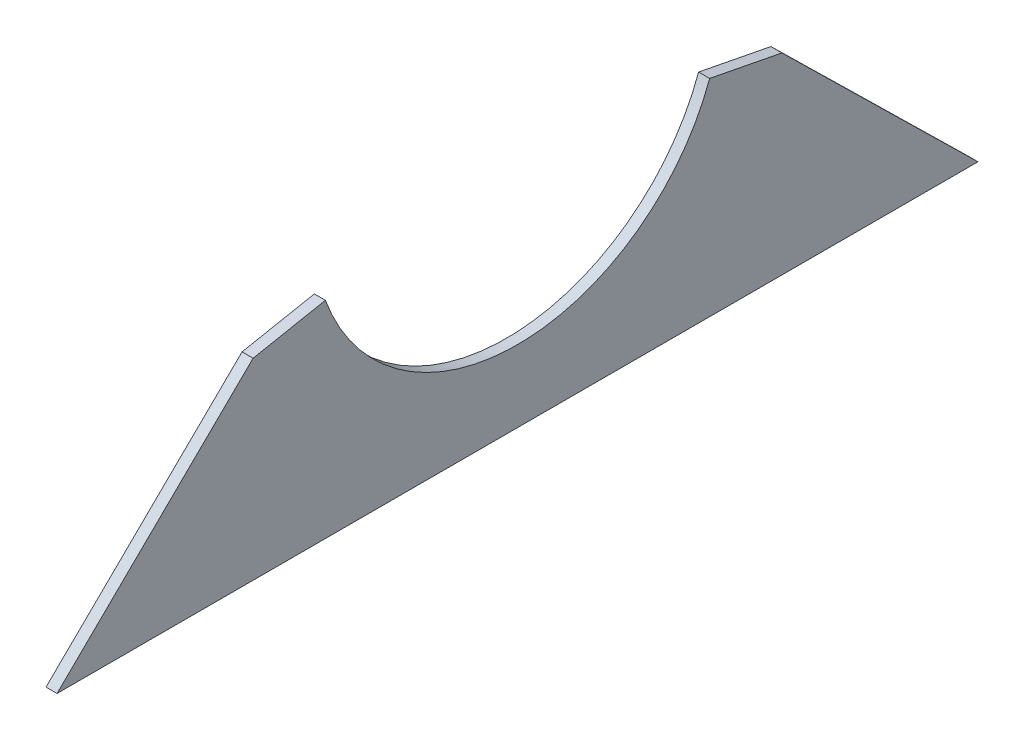
from build123d import *

# Parameters (mm, degrees)
SM_BASE_FLANGE_1_DEPTH = 6


# Sheet-metal steps are written as plain solids
with BuildPart() as part:
    # Sketch 1 → Базовая кромка1 (new body)
    with BuildSketch(Plane(origin=(0, 0, 0), x_dir=(0, 0, -1), z_dir=(1, 0, 0))):
        with BuildLine():
            Line((250, -150), (-250, -150))
            Line((-250, -150), (-143.570968245, -45.596595724))
            Line((-143.570968245, -45.596595724), (-104.305880907, -37.964235909))
            ThreePointArc((-104.305880907, -37.964235909), (0, -111), (104.305880907, -37.964235909))
            Line((104.305880907, -37.964235909), (143.570968245, -45.596595724))
            Line((143.570968245, -45.596595724), (250, -150))
        make_face()
    extrude(amount=-SM_BASE_FLANGE_1_DEPTH)


solid = part.part
